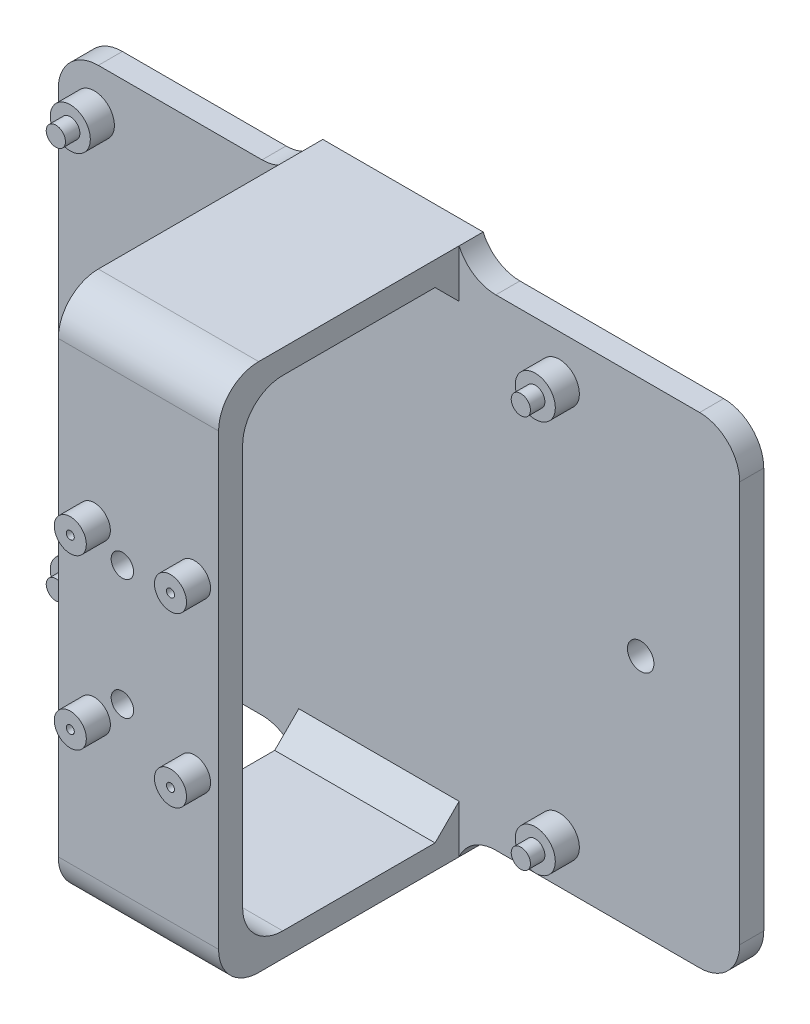
from build123d import *

# Parameters (mm, degrees)
SKETCH1_W           = 85
SKETCH1_H           = 60
BOSS_EXTRUDE1_DEPTH = 3
SKETCH2_R           = 2.5
BOSS_EXTRUDE2_DEPTH = 3
SKETCH3_R           = 1.2
BOSS_EXTRUDE3_DEPTH = 1.8
SKETCH5_W           = 20
SKETCH5_H           = 30
BOSS_EXTRUDE4_DEPTH = 3
SKETCH6_W           = 20
SKETCH6_H           = 66
BOSS_EXTRUDE5_DEPTH = 3
SKETCH7_R           = 2
BOSS_EXTRUDE6_DEPTH = 3
SKETCH8_R           = 0.5
CUT_EXTRUDE2_DEPTH  = 5
SKETCH9_R           = 1.65
CUT_EXTRUDE3_DEPTH  = 3
FILLET1_R           = 5
CHAMFER1_SIZE       = 3
SKETCH10_R          = 1.4
CUT_EXTRUDE4_DEPTH  = 3


with BuildPart() as part:
    # Sketch1 → Boss-Extrude1 (new body)
    with BuildSketch(Plane.XY):
        Rectangle(SKETCH1_W, SKETCH1_H)
    extrude(amount=BOSS_EXTRUDE1_DEPTH)

    # Sketch2 → Boss-Extrude2 (add)
    with BuildSketch(Plane.XY.offset(3)):
        with Locations((-38, -24.5)):
            Circle(SKETCH2_R)
        with Locations((-38, 24.5)):
            Circle(SKETCH2_R)
        with Locations((20, 24.5)):
            Circle(SKETCH2_R)
        with Locations((20, -24.5)):
            Circle(SKETCH2_R)
    extrude(amount=BOSS_EXTRUDE2_DEPTH)

    # Sketch3 → Boss-Extrude3 (add)
    with BuildSketch(Plane.XY.offset(6)):
        with Locations((-38, 24.5)):
            Circle(SKETCH3_R)
        with Locations((20, 24.5)):
            Circle(SKETCH3_R)
        with Locations((-38, -24.5)):
            Circle(SKETCH3_R)
        with Locations((20, -24.5)):
            Circle(SKETCH3_R)
    extrude(amount=BOSS_EXTRUDE3_DEPTH)

    # Sketch5 → Boss-Extrude4 (add)
    with BuildSketch(Plane.XZ.offset(30)):
        with Locations((-2.5, 15)):
            Rectangle(SKETCH5_W, SKETCH5_H)
    boss_extrude4 = extrude(amount=BOSS_EXTRUDE4_DEPTH)

    # Mirror1: Boss-Extrude4 across plane
    add(boss_extrude4.mirror(Plane.ZX))

    # Sketch6 → Boss-Extrude5 (add)
    with BuildSketch(Plane.XY.offset(30)):
        with Locations((-2.5, 0)):
            Rectangle(SKETCH6_W, SKETCH6_H)
    extrude(amount=BOSS_EXTRUDE5_DEPTH)

    # Sketch7 → Boss-Extrude6 (add)
    with BuildSketch(Plane.XY.offset(33)):
        with Locations((-8, -10.5)):
            Circle(SKETCH7_R)
        with Locations((4.5, -10.5)):
            Circle(SKETCH7_R)
        with Locations((-8, 10.5)):
            Circle(SKETCH7_R)
        with Locations((4.5, 10.5)):
            Circle(SKETCH7_R)
    extrude(amount=BOSS_EXTRUDE6_DEPTH)

    # Sketch8 → Cut-Extrude2 (cut)
    with BuildSketch(Plane.XY.offset(36)):
        with Locations((-8, 10.5)):
            Circle(SKETCH8_R)
        with Locations((4.5, 10.5)):
            Circle(SKETCH8_R)
        with Locations((-8, -10.5)):
            Circle(SKETCH8_R)
        with Locations((4.5, -10.5)):
            Circle(SKETCH8_R)
    extrude(amount=-CUT_EXTRUDE2_DEPTH, mode=Mode.SUBTRACT)

    # Sketch9 → Cut-Extrude3 (cut)
    with BuildSketch(Plane.XY.offset(3)):
        with Locations((-30.15, 0)):
            Circle(SKETCH9_R)
        with Locations((30.15, 0)):
            Circle(SKETCH9_R)
    extrude(amount=-CUT_EXTRUDE3_DEPTH, mode=Mode.SUBTRACT)

    # Fillet1
    # the kernel refuses this fillet: 5 mm, written as the material it adds along each edge
    with BuildSketch(Plane(origin=(7.5, -30, 0), x_dir=(0, -1, 0), z_dir=(0, 0, 1)), Plane(origin=(-12.5, -30, 3), x_dir=(0, -1, 0), z_dir=(0, 0, -1))) as fillet1_piece_1:
        with BuildLine():
            CenterArc((5, 4.582575695), FILLET1_R, 180, 66.421821522)
            Line((0, 4.582575695), (0, 0))
            Line((0, 0), (3, 0))
        make_face()
    extrude(amount=3)
    with BuildSketch(Plane(origin=(-12.5, 30, 3), x_dir=(-1, 0, 0), z_dir=(0, 0, -1))) as fillet1_piece_2:
        with BuildLine():
            CenterArc((4.582575695, 5), FILLET1_R, 203.578178478, 66.421821522)
            Line((0, 3), (0, 0))
            Line((0, 0), (4.582575695, 0))
        make_face()
    extrude(amount=3)
    with BuildSketch(Plane(origin=(7.5, 30, 0), x_dir=(0, 1, 0), z_dir=(0, 0, 1))) as fillet1_piece_3:
        with BuildLine():
            CenterArc((5, -4.582575695), FILLET1_R, 113.578178478, 66.421821522)
            Line((0, -4.582575695), (0, 0))
            Line((0, 0), (3, 0))
        make_face()
    extrude(amount=3)
    with BuildSketch(Plane(origin=(7.5, -30, 30), x_dir=(0, 1, 0), z_dir=(-1, 0, 0)), Plane(origin=(7.5, 30, 30), x_dir=(0, 0, -1), z_dir=(-1, 0, 0))) as fillet1_piece_4:
        with BuildLine():
            CenterArc((FILLET1_R, FILLET1_R), FILLET1_R, 180, 90)
            Line((0, FILLET1_R), (0, 0))
            Line((0, 0), (FILLET1_R, 0))
        make_face()
    extrude(amount=20)
    # the kernel refuses this fillet: 5 mm, written as the material it takes off along each edge
    with BuildSketch(Plane(origin=(42.5, 30, -12.5), x_dir=(-1, 0, 0), z_dir=(0, 0, 1)), Plane(origin=(42.5, -30, -12.5), x_dir=(0, 1, 0), z_dir=(0, 0, 1))) as fillet1_2_piece_1:
        with BuildLine():
            CenterArc((FILLET1_R, FILLET1_R), FILLET1_R, 180, 90)
            Line((0, FILLET1_R), (0, 0))
            Line((0, 0), (FILLET1_R, 0))
        make_face()
    extrude(amount=28, mode=Mode.SUBTRACT)
    with BuildSketch(Plane(origin=(-42.5, 30, -12.5), x_dir=(1, 0, 0), z_dir=(0, 0, 1)), Plane(origin=(-42.5, -30, -12.5), x_dir=(0, 1, 0), z_dir=(0, 0, 1))) as fillet1_2_piece_2:
        with BuildLine():
            CenterArc((FILLET1_R, -FILLET1_R), FILLET1_R, 90, 90)
            Line((0, -FILLET1_R), (0, 0))
            Line((0, 0), (FILLET1_R, 0))
        make_face()
    extrude(amount=28, mode=Mode.SUBTRACT)
    with BuildSketch(Plane(origin=(20, -33, 33), x_dir=(0, 0, -1), z_dir=(-1, 0, 0)), Plane(origin=(-25, 33, 33), x_dir=(0, 0, -1), z_dir=(1, 0, 0))) as fillet1_2_piece_3:
        with BuildLine():
            CenterArc((FILLET1_R, -FILLET1_R), FILLET1_R, 90, 90)
            Line((0, -FILLET1_R), (0, 0))
            Line((0, 0), (FILLET1_R, 0))
        make_face()
    extrude(amount=45, mode=Mode.SUBTRACT)

    # Chamfer1
    chamfer1_edges = [part.edges().sort_by_distance(p)[0] for p in [
        (-2.5, -30, 3),
        (-2.5, 30, 3),
    ]]
    chamfer(chamfer1_edges, length=CHAMFER1_SIZE)

    # Sketch10 → Cut-Extrude4 (cut)
    with BuildSketch(Plane(origin=(0, 0, 30), x_dir=(-1, 0, 0), z_dir=(0, 0, -1))):
        with Locations((4.5, -7.5)):
            Circle(SKETCH10_R)
        with Locations((4.5, 7.5)):
            Circle(SKETCH10_R)
    extrude(amount=-CUT_EXTRUDE4_DEPTH, mode=Mode.SUBTRACT)


solid = part.part
